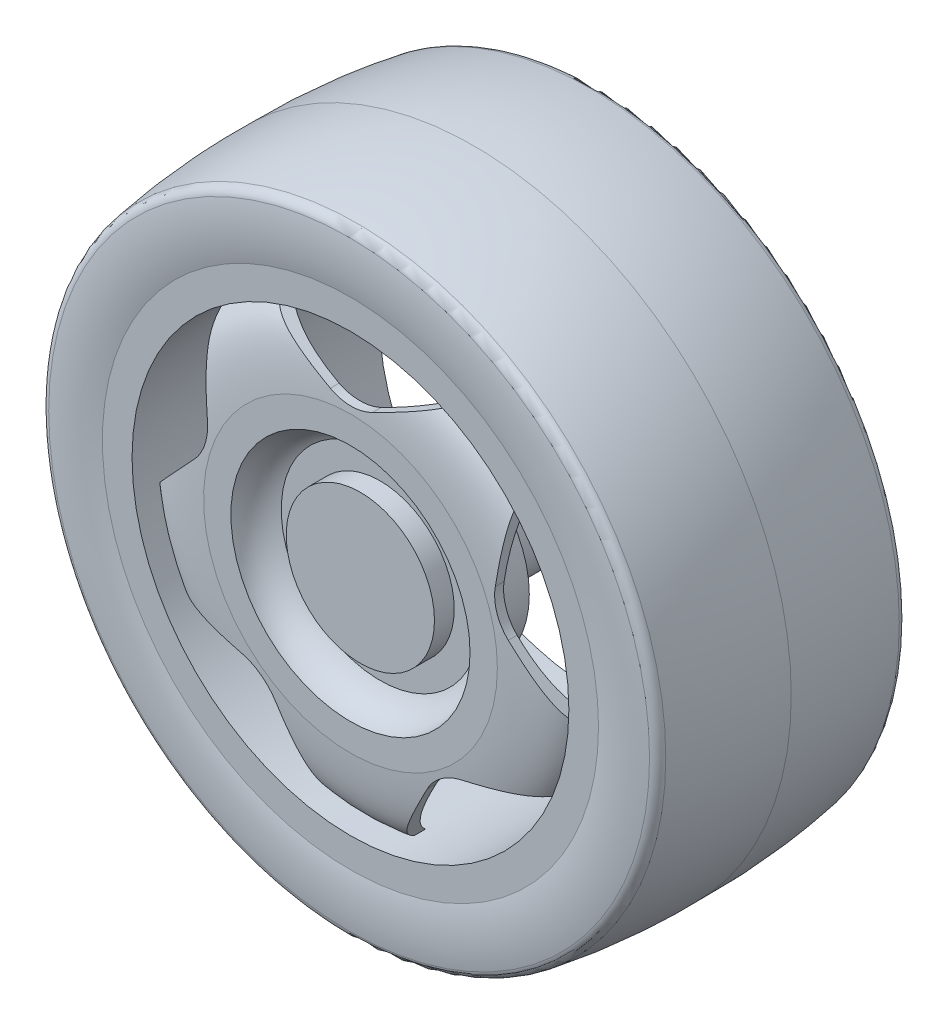
from build123d import *

# Parameters (mm, degrees)
CUT_EXTRUDE1_DEPTH  = 10
SKETCH3_R           = 6
BOSS_EXTRUDE1_DEPTH = 25
CUT_EXTRUDE2_DEPTH  = 12


with BuildPart() as part:
    # Sketch1 → Revolve1 (revolve)
    with BuildSketch(Plane(origin=(0, 0, 0), x_dir=(0, 0, -1), z_dir=(1, 0, 0))):
        with BuildLine():
            Line((-0.010712, 12.1), (-0.010712, 14.864338))
            add(Edge.make_bspline(
                [(2.989288, 22.1), (1.233895, 21.087391), (0.275128, 20.018956), (-0.010712, 14.864338)],
                knots=[0, 0, 0, 0, 1, 1, 1, 1], degree=3))
            Line((2.989288, 22.1), (-0.010712, 22.1))
            Line((-0.010712, 22.1), (-0.010712, 25.1))
            Line((-0.010712, 25.1), (24.989288, 25.1))
            Line((24.989288, 25.1), (24.989288, 22.1))
            Line((24.989288, 22.1), (4.086781, 22.1))
            ThreePointArc((4.086781, 22.1), (1.62229, 18.874187), (0.989288, 14.864338))
            Line((0.989288, 14.864338), (0.989288, 12.992036))
            ThreePointArc((0.989288, 12.992036), (2.931105, 11.902942), (4.086781, 10))
            Line((4.086781, 10), (8.086781, 10))
            Line((8.086781, 10), (8.086781, 0))
            Line((8.086781, 0), (0.989288, 0))
            Line((0.989288, 0), (0.989288, 7.5))
            Line((0.989288, 7.5), (2.989288, 7.5))
            Line((2.989288, 7.5), (2.989288, 10))
            ThreePointArc((2.989288, 10), (1.761669, 11.439115), (-0.010712, 12.1))
        make_face()
    revolve(axis=Axis((0, 0, 13.275868), (0, 0, -1)))

    # Sketch2 → Cut-Extrude1 (cut)
    with BuildSketch(Plane.XY.offset(0.010712)):
        with BuildLine():
            Line((-10, 19.70812), (-2.129814, 16.002742))
            ThreePointArc((-2.129814, 16.002742), (0, 15.526445), (2.129814, 16.002742))
            Line((2.129814, 16.002742), (10, 19.70812))
            ThreePointArc((10, 19.70812), (0, 22.1), (-10, 19.70812))
        make_face()
        with BuildLine():
            Line((15.653366, 15.600709), (14.561363, 6.970693))
            ThreePointArc((14.561363, 6.970693), (14.766527, 4.797935), (15.877661, 2.919546))
            Line((15.877661, 2.919546), (21.833706, -3.420421))
            ThreePointArc((21.833706, -3.420421), (21.018349, 6.829276), (15.653366, 15.600709))
        make_face()
        with BuildLine():
            Line((19.674312, -10.066352), (11.129231, -11.694617))
            ThreePointArc((11.129231, -11.694617), (9.126216, -12.561158), (7.68312, -14.198363))
            Line((7.68312, -14.198363), (3.493972, -21.822057))
            ThreePointArc((3.493972, -21.822057), (12.990054, -17.879276), (19.674312, -10.066352))
        make_face()
        with BuildLine():
            Line((-3.493972, -21.822057), (-7.68312, -14.198363))
            ThreePointArc((-7.68312, -14.198363), (-9.126216, -12.561158), (-11.129231, -11.694617))
            Line((-11.129231, -11.694617), (-19.674312, -10.066352))
            ThreePointArc((-19.674312, -10.066352), (-12.990054, -17.879276), (-3.493972, -21.822057))
        make_face()
        with BuildLine():
            Line((-21.833706, -3.420421), (-15.877661, 2.919546))
            ThreePointArc((-15.877661, 2.919546), (-14.766527, 4.797935), (-14.561363, 6.970693))
            Line((-14.561363, 6.970693), (-15.653366, 15.600709))
            ThreePointArc((-15.653366, 15.600709), (-21.018349, 6.829276), (-21.833706, -3.420421))
        make_face()
    extrude(amount=-CUT_EXTRUDE1_DEPTH, mode=Mode.SUBTRACT)

    # Sketch3 → Boss-Extrude1 (add)
    with BuildSketch(Plane(origin=(0, 0, -8.086781), x_dir=(-1, 0, 0), z_dir=(0, 0, -1))):
        Circle(SKETCH3_R)
    extrude(amount=BOSS_EXTRUDE1_DEPTH)

    # Sketch4 → Cut-Extrude2 (cut)
    with BuildSketch(Plane(origin=(0, 0, -33.086781), x_dir=(-1, 0, 0), z_dir=(0, 0, -1))):
        with BuildLine():
            Line((-2.547548, 2.4), (2.547548, 2.4))
            ThreePointArc((2.547548, 2.4), (3.5, 0), (2.547548, -2.4))
            Line((2.547548, -2.4), (-2.547548, -2.4))
            ThreePointArc((-2.547548, -2.4), (-3.5, 0), (-2.547548, 2.4))
        make_face()
    extrude(amount=-CUT_EXTRUDE2_DEPTH, mode=Mode.SUBTRACT)

    # Sketch5 → Revolve2 (revolve)
    with BuildSketch(Plane(origin=(0, 0, 0), x_dir=(0, 0, -1), z_dir=(1, 0, 0))):
        with BuildLine():
            Line((-0.010712, 25.1), (24.989288, 25.1))
            ThreePointArc((24.989288, 25.1), (25.309907, 27.741636), (25.124902, 30.39622))
            ThreePointArc((25.124902, 30.39622), (24.845895, 30.938967), (24.30342, 31.218502))
            ThreePointArc((24.30342, 31.218502), (18.416479, 31.928969), (12.489288, 32.1))
            ThreePointArc((12.489288, 32.1), (6.562098, 31.928969), (0.675157, 31.218502))
            ThreePointArc((0.675157, 31.218502), (0.132681, 30.938967), (-0.146326, 30.39622))
            ThreePointArc((-0.146326, 30.39622), (-0.33133, 27.741636), (-0.010712, 25.1))
        make_face()
    revolve(axis=Axis((0, 0, 0), (0, 0, -1)))


solid = part.part
